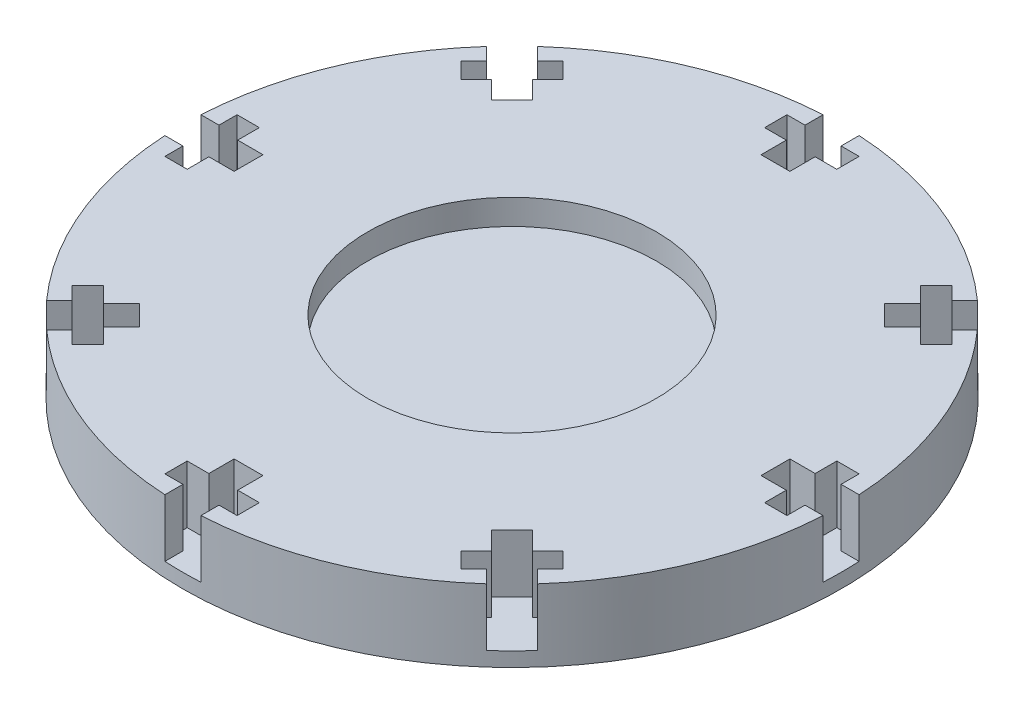
from build123d import *

# Parameters (mm, degrees)
SKETCH1_R           = 45.66
BOSS_EXTRUDE1_DEPTH = 10
SKETCH2_R           = 20
CUT_EXTRUDE1_DEPTH  = 3.5
CUT_EXTRUDE2_DEPTH  = 8
CIRPATTERN1_COUNT   = 8


with BuildPart() as part:
    # Sketch1 → Boss-Extrude1 (new body)
    with BuildSketch(Plane(origin=(0, 0, 0), x_dir=(1, 0, 0), z_dir=(0, 1, 0))):
        Circle(SKETCH1_R)
    extrude(amount=BOSS_EXTRUDE1_DEPTH)

    # Sketch2 → Cut-Extrude1 (cut)
    with BuildSketch(Plane(origin=(0, 10, 0), x_dir=(1, 0, 0), z_dir=(0, 1, 0))):
        Circle(SKETCH2_R)
    cut_extrude1 = extrude(amount=-CUT_EXTRUDE1_DEPTH, mode=Mode.SUBTRACT)

    # Mirror1: Cut-Extrude1 across plane
    add(cut_extrude1.mirror(Plane.ZX.offset(5)), mode=Mode.SUBTRACT)

    # Sketch3 → Cut-Extrude2 (cut)
    with BuildSketch(Plane(origin=(0, 10, 0), x_dir=(1, 0, 0), z_dir=(0, 1, 0))):
        Polygon((-5, -40), (-2, -40), (-2, -36.5), (2, -36.5), (2, -40), (5, -40), (5, -43.093913803), (2.5, -43.093913803), (2.5, -46.011189111), (-2.5, -46.011189111), (-2.5, -43.093913803), (-5, -43.093913803), align=None)
    cut_extrude2 = extrude(amount=-CUT_EXTRUDE2_DEPTH, mode=Mode.SUBTRACT)

    # CirPattern1: Cut-Extrude2 ×8 about axis
    cirpattern1_axis = Axis((0, 10, 0), (0, 1, 0))
    for i in range(1, CIRPATTERN1_COUNT):
        add(cut_extrude2.rotate(cirpattern1_axis, i * 360 / CIRPATTERN1_COUNT), mode=Mode.SUBTRACT)


solid = part.part
